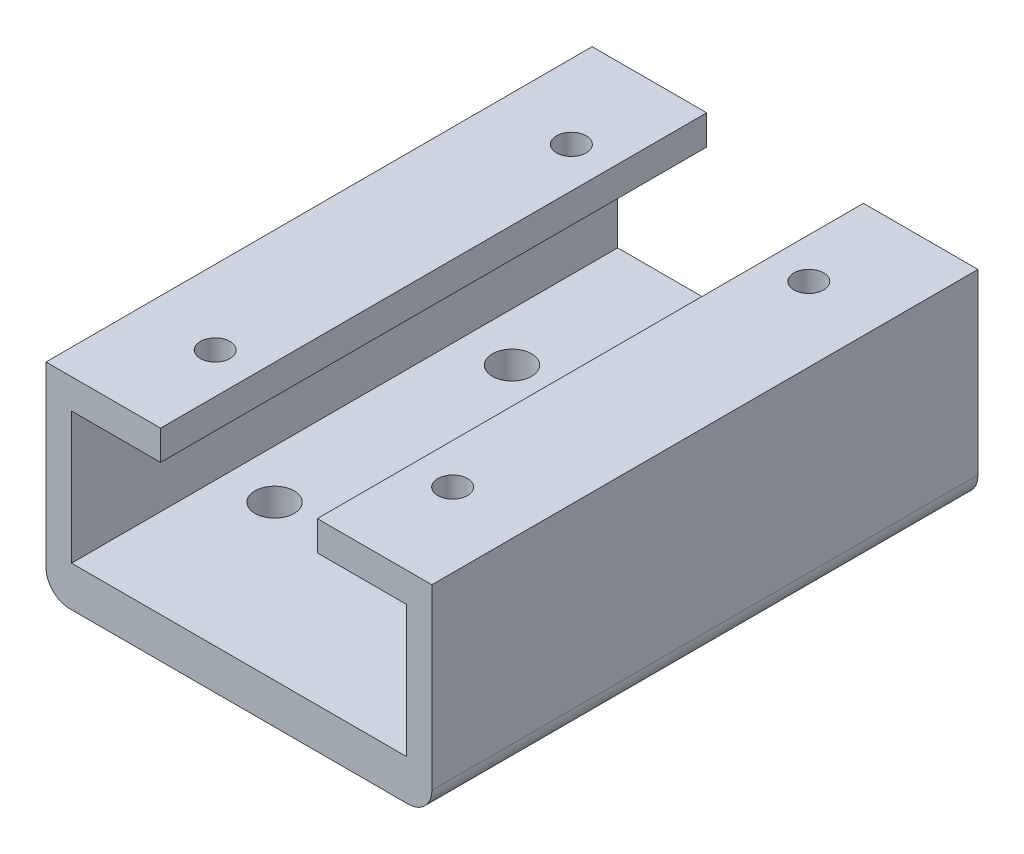
from build123d import *

# Parameters (mm, degrees)
SKETCH_1_W          = 32.5
SKETCH_1_H          = 46
EXTRUDE_1_DEPTH     = 17
CUT_EXTRUDE_2_DEPTH = 52.662970298
CUT_EXTRUDE_3_REACH = 34.895
SKETCH_4_R          = 1.65
SKETCH_5_R          = 1.25
CUT_EXTRUDE_4_DEPTH = 2
FILLET_1_R          = 2


with BuildPart() as part:
    # 草图1 → 凸台-拉伸1 (new body)
    with BuildSketch(Plane(origin=(0, 0, 0), x_dir=(1, 0, 0), z_dir=(0, 1, 0))):
        Rectangle(SKETCH_1_W, SKETCH_1_H)
    extrude(amount=EXTRUDE_1_DEPTH)

    # 草图2 → 切除-拉伸2 (cut, through all)
    with BuildSketch(Plane(origin=(0, 0, -23), x_dir=(-1, 0, 0), z_dir=(0, 0, -1))):
        Polygon((-6.6, 17), (-6.6, 14.5), (-14.1, 14.5), (-14.1, 3.4), (14.1, 3.4), (14.1, 14.5), (6.6, 14.5), (6.6, 17), align=None)
    extrude(amount=-CUT_EXTRUDE_2_DEPTH, mode=Mode.SUBTRACT)

    # 草图4 → 切除-拉伸3 (cut, up to next)
    with BuildSketch(Plane.XZ, mode=Mode.PRIVATE) as cut_extrude_3_sk1:
        with Locations((-10, 10)):
            Circle(SKETCH_4_R)
    cut_extrude_3_tool1 = extrude(cut_extrude_3_sk1.sketch, amount=-CUT_EXTRUDE_3_REACH, mode=Mode.PRIVATE) & part.part
    # 草图4 → 切除-拉伸3 (cut, up to next)
    with BuildSketch(Plane.XZ, mode=Mode.PRIVATE) as cut_extrude_3_sk2:
        with Locations((10, 10)):
            Circle(SKETCH_4_R)
    cut_extrude_3_tool2 = extrude(cut_extrude_3_sk2.sketch, amount=-CUT_EXTRUDE_3_REACH, mode=Mode.PRIVATE) & part.part
    # 草图4 → 切除-拉伸3 (cut, up to next)
    with BuildSketch(Plane.XZ, mode=Mode.PRIVATE) as cut_extrude_3_sk3:
        with Locations((10, -10)):
            Circle(SKETCH_4_R)
    cut_extrude_3_tool3 = extrude(cut_extrude_3_sk3.sketch, amount=-CUT_EXTRUDE_3_REACH, mode=Mode.PRIVATE) & part.part
    # 草图4 → 切除-拉伸3 (cut, up to next)
    with BuildSketch(Plane.XZ, mode=Mode.PRIVATE) as cut_extrude_3_sk4:
        with Locations((-10, -10)):
            Circle(SKETCH_4_R)
    cut_extrude_3_tool4 = extrude(cut_extrude_3_sk4.sketch, amount=-CUT_EXTRUDE_3_REACH, mode=Mode.PRIVATE) & part.part
    add(cut_extrude_3_tool1.solids().sort_by_distance((-10, 0, 10))[0], mode=Mode.SUBTRACT)
    add(cut_extrude_3_tool2.solids().sort_by_distance((10, 0, 10))[0], mode=Mode.SUBTRACT)
    add(cut_extrude_3_tool3.solids().sort_by_distance((10, 0, -10))[0], mode=Mode.SUBTRACT)
    add(cut_extrude_3_tool4.solids().sort_by_distance((-10, 0, -10))[0], mode=Mode.SUBTRACT)

    # 草图5 → 切除-拉伸4 (cut)
    with BuildSketch(Plane(origin=(0, 17, 0), x_dir=(1, 0, 0), z_dir=(0, 1, 0))):
        with Locations((-10, 15)):
            Circle(SKETCH_5_R)
        with Locations((10, 15)):
            Circle(SKETCH_5_R)
        with Locations((10, -15)):
            Circle(SKETCH_5_R)
        with Locations((-10, -15)):
            Circle(SKETCH_5_R)
    extrude(amount=-CUT_EXTRUDE_4_DEPTH, mode=Mode.SUBTRACT)

    # 圆角1
    fillet_1_edges = [part.edges().sort_by_distance(p)[0] for p in [
        (16.25, 0, 0),
        (-16.25, 0, 0),
    ]]
    fillet(fillet_1_edges, radius=FILLET_1_R)


solid = part.part
